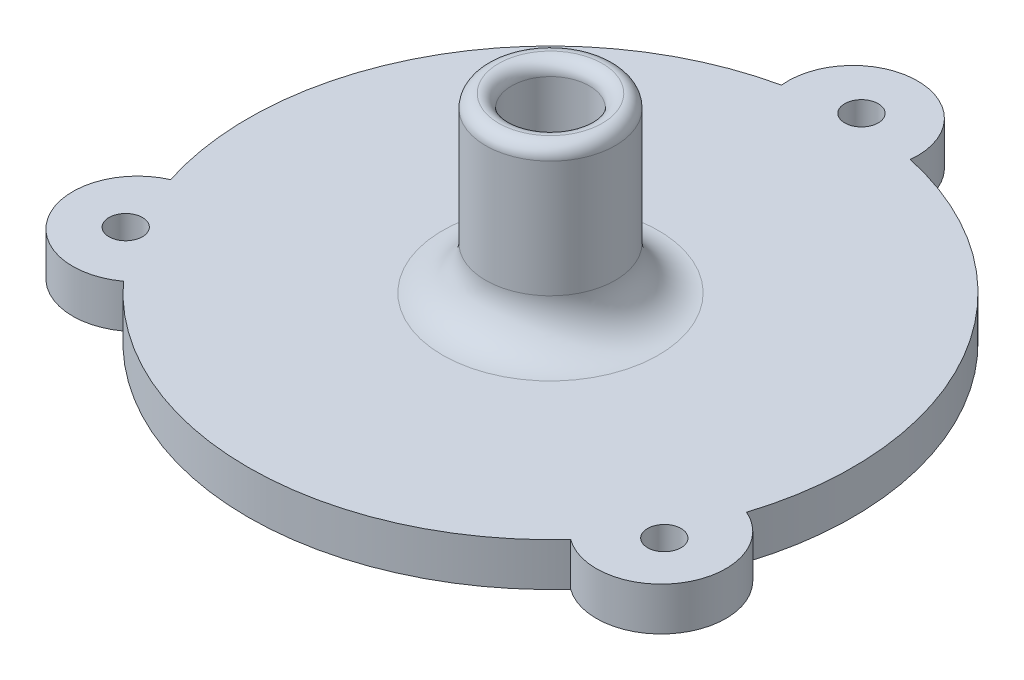
from build123d import *

# Parameters (mm, degrees)
SKETCH1_R           = 28
BOSS_EXTRUDE1_DEPTH = 4
SKETCH2_R           = 6
BOSS_EXTRUDE2_DEPTH = 4
SKETCH3_R           = 1.55
CUT_EXTRUDE1_DEPTH  = 46.683525867
SKETCH4_R           = 3.6
CUT_EXTRUDE2_DEPTH  = 46.683525867
BOSS_EXTRUDE3_START = 16
SKETCH5_R           = 6
SKETCH5_R_2         = 3.6
BOSS_EXTRUDE3_DEPTH = 16
FILLET1_R           = 4
FILLET2_R           = 1.2
FILLET3_R           = 2


with BuildPart() as part:
    # Sketch1 → Boss-Extrude1 (new body)
    with BuildSketch(Plane(origin=(0, 0, 0), x_dir=(1, 0, 0), z_dir=(0, 1, 0))):
        with Locations(Location((0, 0, 0), (0, 0, 270))):
            Circle(SKETCH1_R)
    extrude(amount=BOSS_EXTRUDE1_DEPTH)

    # Sketch2 → Boss-Extrude2 (add)
    with BuildSketch(Plane(origin=(0, 4, 0), x_dir=(1, 0, 0), z_dir=(0, 1, 0))):
        with Locations((0, 28)):
            Circle(SKETCH2_R)
        with Locations((24.248711306, -14)):
            Circle(SKETCH2_R)
        with Locations((-24.248711306, -14)):
            Circle(SKETCH2_R)
    extrude(amount=-BOSS_EXTRUDE2_DEPTH)

    # Sketch3 → Cut-Extrude1 (cut, through all)
    with BuildSketch(Plane(origin=(0, 4, 0), x_dir=(1, 0, 0), z_dir=(0, 1, 0))):
        with Locations(Location((0, 28.8, 0), (0, 0, 270))):
            Circle(SKETCH3_R)
        with Locations(Location((24.941531629, -14.4, 0), (0, 0, 270))):
            Circle(SKETCH3_R)
        with Locations(Location((-24.941531629, -14.4, 0), (0, 0, 270))):
            Circle(SKETCH3_R)
    extrude(amount=-CUT_EXTRUDE1_DEPTH, mode=Mode.SUBTRACT)

    # Sketch4 → Cut-Extrude2 (cut, through all)
    with BuildSketch(Plane(origin=(0, 4, 0), x_dir=(1, 0, 0), z_dir=(0, 1, 0))):
        with Locations(Location((0, 0, 0), (0, 0, 270))):
            Circle(SKETCH4_R)
    extrude(amount=-CUT_EXTRUDE2_DEPTH, mode=Mode.SUBTRACT)

    # Sketch5 → Boss-Extrude3 (add)
    with BuildSketch(Plane(origin=(0, 4, 0), x_dir=(1, 0, 0), z_dir=(0, 1, 0)).offset(BOSS_EXTRUDE3_START)):
        with Locations(Location((0, 0, 0), (0, 0, 270))):
            Circle(SKETCH5_R)
        with Locations(Location((0, 0, 0), (0, 0, 270))):
            Circle(SKETCH5_R_2, mode=Mode.SUBTRACT)
    extrude(amount=-BOSS_EXTRUDE3_DEPTH)

    # Fillet1
    fillet1_edges = [part.edges().sort_by_distance(p)[0] for p in [
        (0, 4, -6),
    ]]
    fillet(fillet1_edges, radius=FILLET1_R)

    # Fillet2
    fillet2_edges = [part.edges().sort_by_distance(p)[0] for p in [
        (0, 20, -6),
        (0, 20, -3.6),
    ]]
    fillet(fillet2_edges, radius=FILLET2_R - 0.0001)  # a hair under: the kernel refuses the full size

    # Fillet3
    fillet3_edges = [part.edges().sort_by_distance(p)[0] for p in [
        (0, 0, -3.6),
    ]]
    fillet(fillet3_edges, radius=FILLET3_R)


solid = part.part
